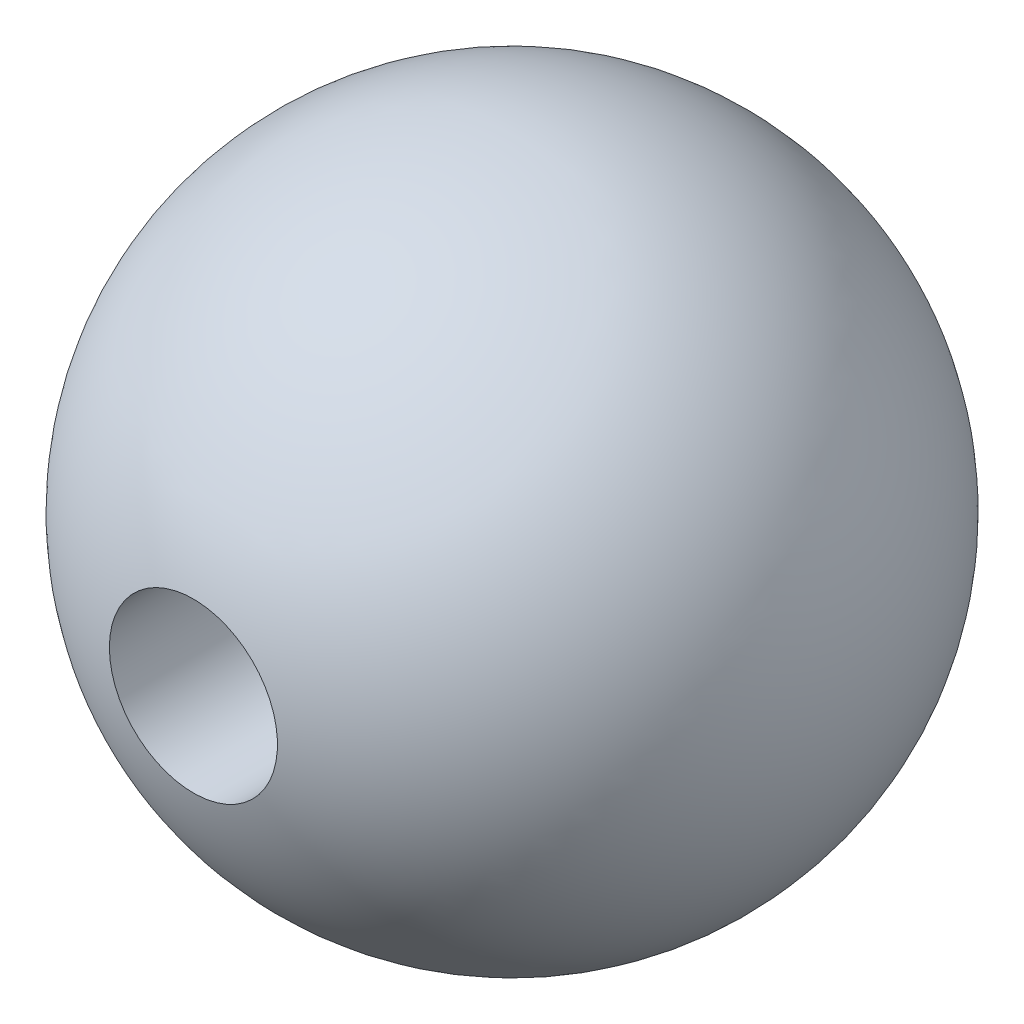
from build123d import *

# Parameters (mm, degrees)
CUT_EXTRUDE1_DEPTH      = 22.997045256
CUT_EXTRUDE1_DEPTH_BACK = 22.997045256
SKETCH2_R               = 3.2385


with BuildPart() as part:
    # Sketch1 → Revolve3 (revolve)
    with BuildSketch(Plane.XY):
        with BuildLine():
            Line((0, 12.7), (0, -12.7))
            ThreePointArc((0, -12.7), (-12.7, 0), (0, 12.7))
        make_face()
    revolve(axis=Axis((0, 0, 0), (0, 1, 0)))

    # Sketch2 → Cut-Extrude1 (cut, two sides: drawn at the far end of the back side and taken through both)
    with BuildSketch(Plane.XY.offset(-CUT_EXTRUDE1_DEPTH_BACK)):
        Circle(SKETCH2_R)
    extrude(amount=CUT_EXTRUDE1_DEPTH + CUT_EXTRUDE1_DEPTH_BACK, mode=Mode.SUBTRACT)


solid = part.part
